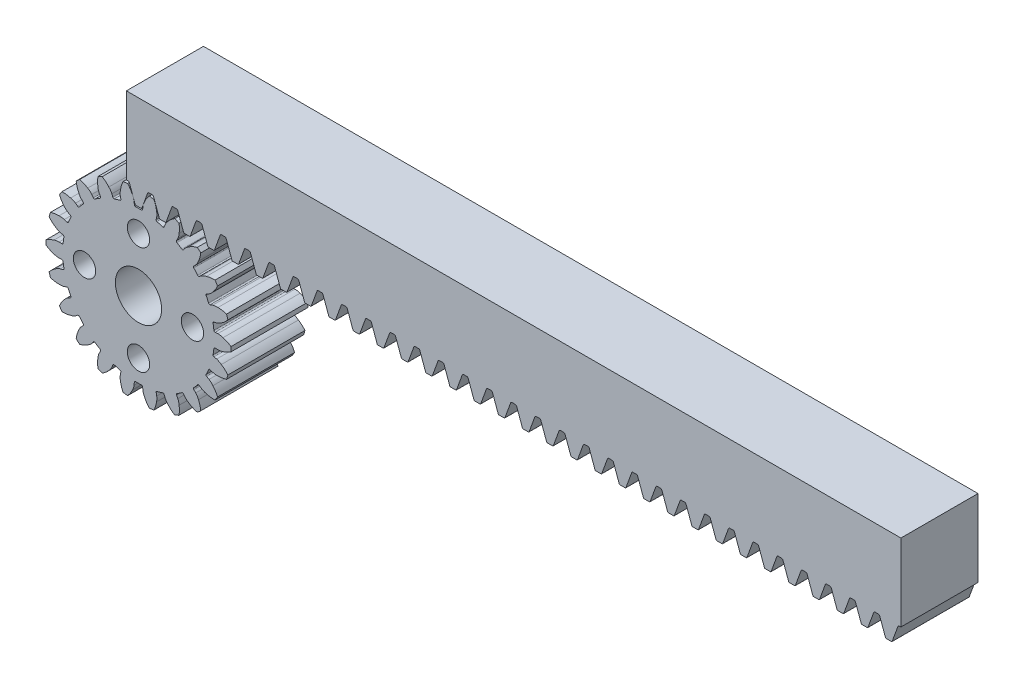
from build123d import *

# Parameters (mm, degrees)
ESBO_O1_R                = 12
RESSALTO_EXTRUS_O1_DEPTH = 5
CORTE_EXTRUS_O1_DEPTH    = 20.697715604
PADR_OCIRCULAR2_COUNT    = 22
ESBO_O3_R                = 3
ESBO_O3_R_2              = 1.45
CORTE_EXTRUS_O3_DEPTH    = 20.647204794
RESSALTO_EXTRUS_O2_DEPTH = 5
PADR_O_LINEAR6_COUNT     = 32
PADR_O_LINEAR6_PITCH     = 3.14
ESBO_O6_W                = 10
ESBO_O6_H                = 10
RESSALTO_EXTRUS_O4_DEPTH = 100


with BuildPart() as part:
    # Esboço1 → Ressalto-extrusão1 (new, symmetric)
    with BuildSketch(Plane.XY):
        Circle(ESBO_O1_R)
    extrude(amount=RESSALTO_EXTRUS_O1_DEPTH, both=True)

    # Esboço2 → Corte-extrusão1 (cut, through all)
    with BuildSketch(Plane.XY.offset(5)):
        with BuildLine():
            Line((0.567385201, 10.321116263), (0.542582109, 9.974246377))
            ThreePointArc((0.542582109, 9.974246377), (0.48975293, 9.866487695), (0.376857463, 9.825775667))
            ThreePointArc((0.376857463, 9.825775667), (0, 9.833), (-0.376857463, 9.825775667))
            ThreePointArc((-0.376857463, 9.825775667), (-0.48975293, 9.866487695), (-0.542582109, 9.974246377))
            Line((-0.542582109, 9.974246377), (-0.567385201, 10.321116263))
            ThreePointArc((-0.567385201, 10.321116263), (-0.648681564, 10.655656512), (-0.784556927, 10.97198571))
            ThreePointArc((-0.784556927, 10.97198571), (-1.058542859, 11.469985403), (-1.409731809, 11.916906319))
            ThreePointArc((-1.409731809, 11.916906319), (0, 12), (1.409731809, 11.916906319))
            ThreePointArc((1.409731809, 11.916906319), (1.058542859, 11.469985403), (0.784556927, 10.97198571))
            ThreePointArc((0.784556927, 10.97198571), (0.648681564, 10.655656512), (0.567385201, 10.321116263))
        make_face()
    corte_extrus_o1 = extrude(amount=-CORTE_EXTRUS_O1_DEPTH, mode=Mode.SUBTRACT)

    # PadrãoCircular2: Corte-extrusão1 ×22 about axis
    padr_ocircular2_axis = Axis((0, 0, 5), (0, 0, 1))
    for i in range(1, PADR_OCIRCULAR2_COUNT):
        add(corte_extrus_o1.rotate(padr_ocircular2_axis, i * 360 / PADR_OCIRCULAR2_COUNT), mode=Mode.SUBTRACT)

    # Esboço3 → Corte-extrusão3 (cut, through all)
    with BuildSketch(Plane.XY.offset(5)):
        Circle(ESBO_O3_R)
        with Locations((0, 7)):
            Circle(ESBO_O3_R_2)
        with Locations((0, -7)):
            Circle(ESBO_O3_R_2)
        with Locations((-7, 0)):
            Circle(ESBO_O3_R_2)
        with Locations((7, 0)):
            Circle(ESBO_O3_R_2)
    extrude(amount=-CORTE_EXTRUS_O3_DEPTH, mode=Mode.SUBTRACT)


with BuildPart() as body_2:
    # Esboço4 → Ressalto-extrusão2 (new, symmetric)
    with BuildSketch(Plane.XY):
        with BuildLine():
            Line((1.180278062, 12.118404029), (0.43319056, 10.065797986))
            ThreePointArc((0.43319056, 10.065797986), (0.396578942, 10.018084796), (0.339221298, 10))
            Line((0.339221298, 10), (-0.339221298, 10))
            ThreePointArc((-0.339221298, 10), (-0.396578942, 10.018084796), (-0.43319056, 10.065797986))
            Line((-0.43319056, 10.065797986), (-1.180278062, 12.118404029))
            ThreePointArc((-1.180278062, 12.118404029), (-1.253501299, 12.213830409), (-1.368216586, 12.25))
            Line((-1.368216586, 12.25), (-1.570795, 12.25))
            Line((-1.570795, 12.25), (-1.570795, 22.25))
            Line((-1.570795, 22.25), (1.570795, 22.25))
            Line((1.570795, 22.25), (1.570795, 12.25))
            Line((1.570795, 12.25), (1.368216586, 12.25))
            ThreePointArc((1.368216586, 12.25), (1.253501299, 12.213830409), (1.180278062, 12.118404029))
        make_face()
    ressalto_extrus_o2 = extrude(amount=RESSALTO_EXTRUS_O2_DEPTH, both=True)



with BuildPart() as padr_o_linear6_1:
    # Padrão linear6: pattern copy
    add(ressalto_extrus_o2.moved(Location(Vector(1, 0, 0) * (1 * PADR_O_LINEAR6_PITCH))))


with BuildPart() as padr_o_linear6_2:
    # Padrão linear6: pattern copy
    add(ressalto_extrus_o2.moved(Location(Vector(1, 0, 0) * (2 * PADR_O_LINEAR6_PITCH))))


with BuildPart() as padr_o_linear6_3:
    # Padrão linear6: pattern copy
    add(ressalto_extrus_o2.moved(Location(Vector(1, 0, 0) * (3 * PADR_O_LINEAR6_PITCH))))


with BuildPart() as padr_o_linear6_4:
    # Padrão linear6: pattern copy
    add(ressalto_extrus_o2.moved(Location(Vector(1, 0, 0) * (4 * PADR_O_LINEAR6_PITCH))))


with BuildPart() as padr_o_linear6_5:
    # Padrão linear6: pattern copy
    add(ressalto_extrus_o2.moved(Location(Vector(1, 0, 0) * (5 * PADR_O_LINEAR6_PITCH))))


with BuildPart() as padr_o_linear6_6:
    # Padrão linear6: pattern copy
    add(ressalto_extrus_o2.moved(Location(Vector(1, 0, 0) * (6 * PADR_O_LINEAR6_PITCH))))


with BuildPart() as padr_o_linear6_7:
    # Padrão linear6: pattern copy
    add(ressalto_extrus_o2.moved(Location(Vector(1, 0, 0) * (7 * PADR_O_LINEAR6_PITCH))))


with BuildPart() as padr_o_linear6_8:
    # Padrão linear6: pattern copy
    add(ressalto_extrus_o2.moved(Location(Vector(1, 0, 0) * (8 * PADR_O_LINEAR6_PITCH))))


with BuildPart() as padr_o_linear6_9:
    # Padrão linear6: pattern copy
    add(ressalto_extrus_o2.moved(Location(Vector(1, 0, 0) * (9 * PADR_O_LINEAR6_PITCH))))


with BuildPart() as padr_o_linear6_10:
    # Padrão linear6: pattern copy
    add(ressalto_extrus_o2.moved(Location(Vector(1, 0, 0) * (10 * PADR_O_LINEAR6_PITCH))))


with BuildPart() as padr_o_linear6_11:
    # Padrão linear6: pattern copy
    add(ressalto_extrus_o2.moved(Location(Vector(1, 0, 0) * (11 * PADR_O_LINEAR6_PITCH))))


with BuildPart() as padr_o_linear6_12:
    # Padrão linear6: pattern copy
    add(ressalto_extrus_o2.moved(Location(Vector(1, 0, 0) * (12 * PADR_O_LINEAR6_PITCH))))


with BuildPart() as padr_o_linear6_13:
    # Padrão linear6: pattern copy
    add(ressalto_extrus_o2.moved(Location(Vector(1, 0, 0) * (13 * PADR_O_LINEAR6_PITCH))))


with BuildPart() as padr_o_linear6_14:
    # Padrão linear6: pattern copy
    add(ressalto_extrus_o2.moved(Location(Vector(1, 0, 0) * (14 * PADR_O_LINEAR6_PITCH))))


with BuildPart() as padr_o_linear6_15:
    # Padrão linear6: pattern copy
    add(ressalto_extrus_o2.moved(Location(Vector(1, 0, 0) * (15 * PADR_O_LINEAR6_PITCH))))


with BuildPart() as padr_o_linear6_16:
    # Padrão linear6: pattern copy
    add(ressalto_extrus_o2.moved(Location(Vector(1, 0, 0) * (16 * PADR_O_LINEAR6_PITCH))))


with BuildPart() as padr_o_linear6_17:
    # Padrão linear6: pattern copy
    add(ressalto_extrus_o2.moved(Location(Vector(1, 0, 0) * (17 * PADR_O_LINEAR6_PITCH))))


with BuildPart() as padr_o_linear6_18:
    # Padrão linear6: pattern copy
    add(ressalto_extrus_o2.moved(Location(Vector(1, 0, 0) * (18 * PADR_O_LINEAR6_PITCH))))


with BuildPart() as padr_o_linear6_19:
    # Padrão linear6: pattern copy
    add(ressalto_extrus_o2.moved(Location(Vector(1, 0, 0) * (19 * PADR_O_LINEAR6_PITCH))))


with BuildPart() as padr_o_linear6_20:
    # Padrão linear6: pattern copy
    add(ressalto_extrus_o2.moved(Location(Vector(1, 0, 0) * (20 * PADR_O_LINEAR6_PITCH))))


with BuildPart() as padr_o_linear6_21:
    # Padrão linear6: pattern copy
    add(ressalto_extrus_o2.moved(Location(Vector(1, 0, 0) * (21 * PADR_O_LINEAR6_PITCH))))


with BuildPart() as padr_o_linear6_22:
    # Padrão linear6: pattern copy
    add(ressalto_extrus_o2.moved(Location(Vector(1, 0, 0) * (22 * PADR_O_LINEAR6_PITCH))))


with BuildPart() as padr_o_linear6_23:
    # Padrão linear6: pattern copy
    add(ressalto_extrus_o2.moved(Location(Vector(1, 0, 0) * (23 * PADR_O_LINEAR6_PITCH))))


with BuildPart() as padr_o_linear6_24:
    # Padrão linear6: pattern copy
    add(ressalto_extrus_o2.moved(Location(Vector(1, 0, 0) * (24 * PADR_O_LINEAR6_PITCH))))


with BuildPart() as padr_o_linear6_25:
    # Padrão linear6: pattern copy
    add(ressalto_extrus_o2.moved(Location(Vector(1, 0, 0) * (25 * PADR_O_LINEAR6_PITCH))))


with BuildPart() as padr_o_linear6_26:
    # Padrão linear6: pattern copy
    add(ressalto_extrus_o2.moved(Location(Vector(1, 0, 0) * (26 * PADR_O_LINEAR6_PITCH))))


with BuildPart() as padr_o_linear6_27:
    # Padrão linear6: pattern copy
    add(ressalto_extrus_o2.moved(Location(Vector(1, 0, 0) * (27 * PADR_O_LINEAR6_PITCH))))


with BuildPart() as padr_o_linear6_28:
    # Padrão linear6: pattern copy
    add(ressalto_extrus_o2.moved(Location(Vector(1, 0, 0) * (28 * PADR_O_LINEAR6_PITCH))))


with BuildPart() as padr_o_linear6_29:
    # Padrão linear6: pattern copy
    add(ressalto_extrus_o2.moved(Location(Vector(1, 0, 0) * (29 * PADR_O_LINEAR6_PITCH))))


with BuildPart() as padr_o_linear6_30:
    # Padrão linear6: pattern copy
    add(ressalto_extrus_o2.moved(Location(Vector(1, 0, 0) * (30 * PADR_O_LINEAR6_PITCH))))


with BuildPart() as padr_o_linear6_31:
    # Padrão linear6: pattern copy
    add(ressalto_extrus_o2.moved(Location(Vector(1, 0, 0) * (31 * PADR_O_LINEAR6_PITCH))))


with BuildPart() as body_2_1:
    add(body_2.part)

    add(padr_o_linear6_1.part)  # Ressalto-extrusão4 merges Padrão linear6_1

    add(padr_o_linear6_2.part)  # Ressalto-extrusão4 merges Padrão linear6_2

    add(padr_o_linear6_3.part)  # Ressalto-extrusão4 merges Padrão linear6_3

    add(padr_o_linear6_4.part)  # Ressalto-extrusão4 merges Padrão linear6_4

    add(padr_o_linear6_5.part)  # Ressalto-extrusão4 merges Padrão linear6_5

    add(padr_o_linear6_6.part)  # Ressalto-extrusão4 merges Padrão linear6_6

    add(padr_o_linear6_7.part)  # Ressalto-extrusão4 merges Padrão linear6_7

    add(padr_o_linear6_8.part)  # Ressalto-extrusão4 merges Padrão linear6_8

    add(padr_o_linear6_9.part)  # Ressalto-extrusão4 merges Padrão linear6_9

    add(padr_o_linear6_10.part)  # Ressalto-extrusão4 merges Padrão linear6_10

    add(padr_o_linear6_11.part)  # Ressalto-extrusão4 merges Padrão linear6_11

    add(padr_o_linear6_12.part)  # Ressalto-extrusão4 merges Padrão linear6_12

    add(padr_o_linear6_13.part)  # Ressalto-extrusão4 merges Padrão linear6_13

    add(padr_o_linear6_14.part)  # Ressalto-extrusão4 merges Padrão linear6_14

    add(padr_o_linear6_15.part)  # Ressalto-extrusão4 merges Padrão linear6_15

    add(padr_o_linear6_16.part)  # Ressalto-extrusão4 merges Padrão linear6_16

    add(padr_o_linear6_17.part)  # Ressalto-extrusão4 merges Padrão linear6_17

    add(padr_o_linear6_18.part)  # Ressalto-extrusão4 merges Padrão linear6_18

    add(padr_o_linear6_19.part)  # Ressalto-extrusão4 merges Padrão linear6_19

    add(padr_o_linear6_20.part)  # Ressalto-extrusão4 merges Padrão linear6_20

    add(padr_o_linear6_21.part)  # Ressalto-extrusão4 merges Padrão linear6_21

    add(padr_o_linear6_22.part)  # Ressalto-extrusão4 merges Padrão linear6_22

    add(padr_o_linear6_23.part)  # Ressalto-extrusão4 merges Padrão linear6_23

    add(padr_o_linear6_24.part)  # Ressalto-extrusão4 merges Padrão linear6_24

    add(padr_o_linear6_25.part)  # Ressalto-extrusão4 merges Padrão linear6_25

    add(padr_o_linear6_26.part)  # Ressalto-extrusão4 merges Padrão linear6_26

    add(padr_o_linear6_27.part)  # Ressalto-extrusão4 merges Padrão linear6_27

    add(padr_o_linear6_28.part)  # Ressalto-extrusão4 merges Padrão linear6_28

    add(padr_o_linear6_29.part)  # Ressalto-extrusão4 merges Padrão linear6_29

    add(padr_o_linear6_30.part)  # Ressalto-extrusão4 merges Padrão linear6_30

    add(padr_o_linear6_31.part)  # Ressalto-extrusão4 merges Padrão linear6_31
    # Esboço6 → Ressalto-extrusão4 (add)
    with BuildSketch(Plane.ZY.offset(1.570795)):
        with Locations((0, 17.25)):
            Rectangle(ESBO_O6_W, ESBO_O6_H)
    extrude(amount=-RESSALTO_EXTRUS_O4_DEPTH)


solid = Compound([part.part, body_2_1.part])
